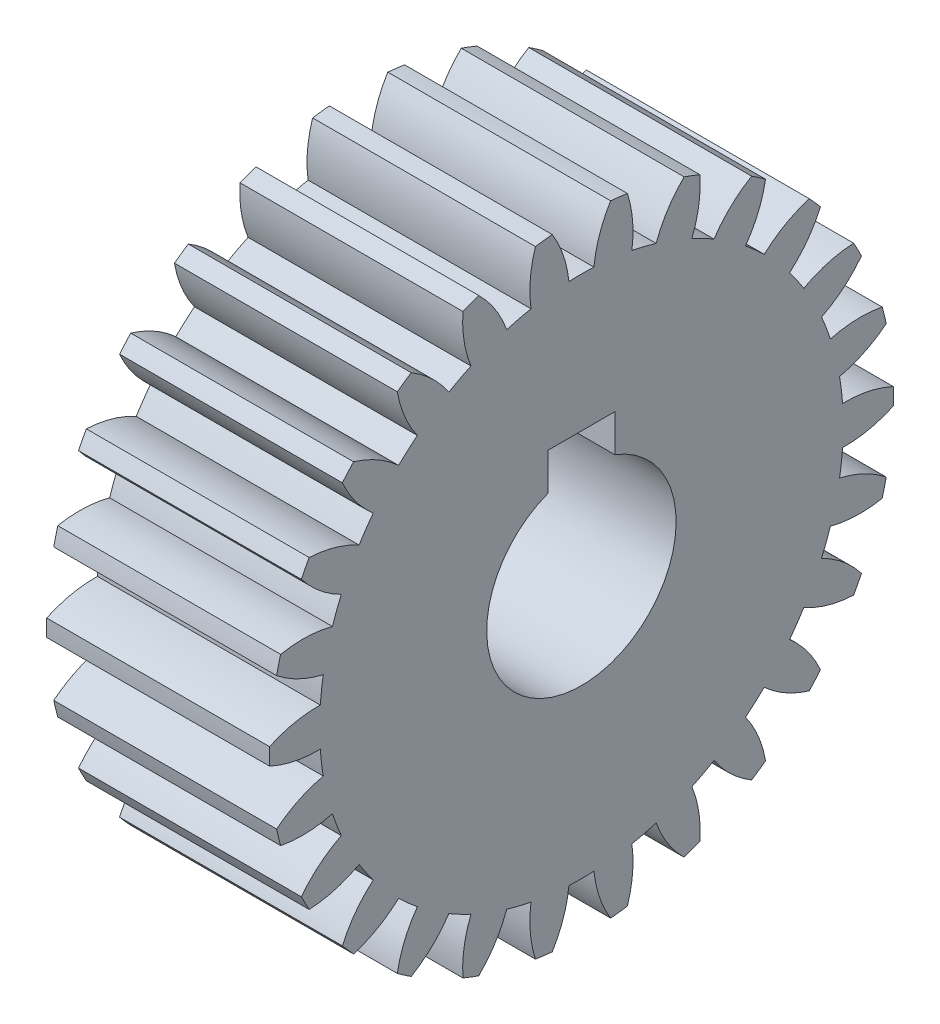
from build123d import *

# Parameters (mm, degrees)
BASPROSKE_W     = 20
BASPROSKE_H     = 28
TOOTHCUT_DEPTH  = 45.362146026
TEETHCUTS_COUNT = 26
TEETHCUTS_ANGLE = 346.153846154
BORSKE_R        = 8.5
BORE_DEPTH      = 50.0000508
KEYSKE_W        = 6
KEYSKE_H        = 11.3
KEYWAY_DEPTH    = 50.0000508


with BuildPart() as part:
    # BasProSke → Base-Revolve (revolve)
    with BuildSketch(Plane(origin=(0, 0, 0), x_dir=(1, 0, 0), z_dir=(0, 1, 0))):
        with Locations((10, 14)):
            Rectangle(BASPROSKE_W, BASPROSKE_H)
    revolve(axis=Axis((-10, 0, 0), (1, 0, 0)))

    # TooCutSke → ToothCut (cut, through all)
    with BuildSketch(Plane(origin=(0, 0, 0), x_dir=(0, 0, -1), z_dir=(1, 0, 0))):
        with BuildLine():
            ThreePointArc((1.121687319, 23.472213755), (0, 23.499), (-1.121687319, 23.472213755))
            ThreePointArc((-1.121687319, 23.472213755), (-1.626477312, 25.772985276), (-2.63606961, 27.901150194))
            ThreePointArc((-2.63606961, 27.901150194), (0, 28.0254), (2.63606961, 27.901150194))
            ThreePointArc((2.63606961, 27.901150194), (1.626477312, 25.772985276), (1.121687319, 23.472213755))
        make_face()
    toothcut = extrude(amount=TOOTHCUT_DEPTH, mode=Mode.SUBTRACT)

    # TeethCuts: ToothCut ×26 about axis
    teethcuts_axis = Axis((-10, 0, 0), (1, 0, 0))
    for i in range(1, TEETHCUTS_COUNT):
        add(toothcut.rotate(teethcuts_axis, i * TEETHCUTS_ANGLE / (TEETHCUTS_COUNT - 1)), mode=Mode.SUBTRACT)

    # BorSke → Bore (cut, symmetric)
    with BuildSketch(Plane(origin=(0, 0, 0), x_dir=(0, 0, -1), z_dir=(1, 0, 0))):
        Circle(BORSKE_R)
    extrude(amount=BORE_DEPTH, both=True, mode=Mode.SUBTRACT)

    # KeySke → Keyway (cut, symmetric)
    with BuildSketch(Plane(origin=(0, 0, 0), x_dir=(0, 0, -1), z_dir=(1, 0, 0))):
        with Locations((0, 5.65)):
            Rectangle(KEYSKE_W, KEYSKE_H)
    extrude(amount=KEYWAY_DEPTH, both=True, mode=Mode.SUBTRACT)


solid = part.part
